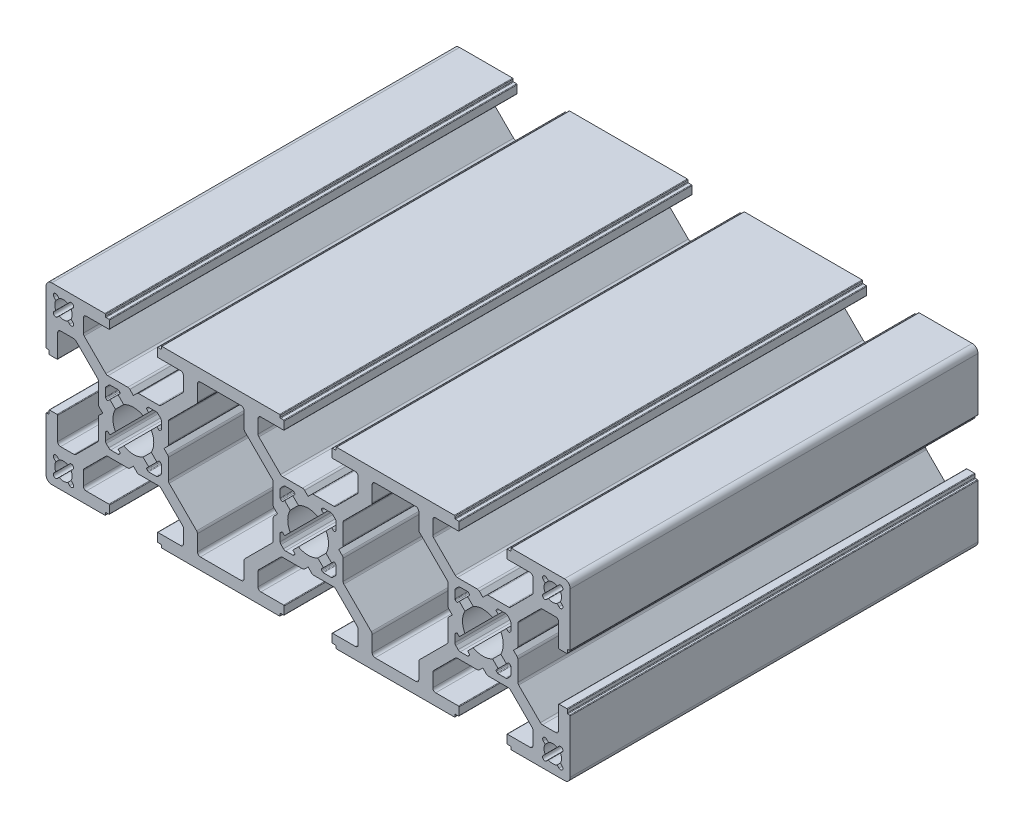
from build123d import *

# Parameters (mm, degrees)
Y_KSEKLIK_EKSTR_ZYON1_DEPTH = 70
Y_KSEKLIK_EKSTR_ZYON2_START = -70
Y_KSEKLIK_EKSTR_ZYON2_DEPTH = 70


# Read off the part's stored shape, not the designer's step: Yükseklik-Ekstrüzyon2
with BuildPart() as part:
    # Çizim1 → Yükseklik-Ekstrüzyon1 (new body)
    with BuildSketch(Plane.XY):
        with BuildLine():
            Line((0.603553391, 5.853553391), (0, 5.25))
            Line((0, 5.25), (0, 3.5))
            ThreePointArc((0, 3.5), (0.858529967, 3.393070335), (1.664601464, 3.078815026))
            Line((1.664601464, 3.078815026), (2.624264069, 4.038477631))
            Line((2.624264069, 4.038477631), (2.341421356, 4.321320344))
            ThreePointArc((2.341421356, 4.321320344), (2.282842712, 4.4627417), (2.341421356, 4.604163056))
            Line((2.341421356, 4.604163056), (2.478679656, 4.741421356))
            ThreePointArc((2.478679656, 4.741421356), (2.543564326, 4.784775907), (2.620101013, 4.8))
            Line((2.620101013, 4.8), (3.885786438, 4.8))
            ThreePointArc((3.885786438, 4.8), (4.077128154, 4.761939766), (4.239339828, 4.653553391))
            Line((4.239339828, 4.653553391), (4.653553391, 4.239339828))
            ThreePointArc((4.653553391, 4.239339828), (4.761939766, 4.077128154), (4.8, 3.885786438))
            Line((4.8, 3.885786438), (4.8, 2.620101013))
            ThreePointArc((4.8, 2.620101013), (4.784775907, 2.543564326), (4.741421356, 2.478679656))
            Line((4.741421356, 2.478679656), (4.604163056, 2.341421356))
            ThreePointArc((4.604163056, 2.341421356), (4.4627417, 2.282842712), (4.321320344, 2.341421356))
            Line((4.321320344, 2.341421356), (4.038477631, 2.624264069))
            Line((4.038477631, 2.624264069), (3.078815026, 1.664601464))
            ThreePointArc((3.078815026, 1.664601464), (3.393070335, 0.858529967), (3.5, 0))
            Line((3.5, 0), (5.25, 0))
            Line((5.25, 0), (5.853553391, 0.603553391))
            ThreePointArc((5.853553391, 0.603553391), (5.961939766, 0.765765065), (6, 0.957106781))
            Line((6, 0.957106781), (6, 4.378679656))
            ThreePointArc((6, 4.378679656), (6.038060234, 4.570021373), (6.146446609, 4.732233047))
            Line((6.146446609, 4.732233047), (9.867766953, 8.453553391))
            Line((9.867766953, 8.453553391), (10.853553391, 9.439339828))
            ThreePointArc((10.853553391, 9.439339828), (10.961939766, 9.601551503), (11, 9.792893219))
            Line((11, 9.792893219), (11, 12.5))
            ThreePointArc((11, 12.5), (11.146446609, 12.853553391), (11.5, 13))
            Line((11.5, 13), (15, 13))
            Line((15, 13), (15, 15))
            Line((15, 15), (14, 15))
            Line((14, 15), (4.9, 15))
            ThreePointArc((4.9, 15), (4.829289322, 14.970710678), (4.8, 14.9))
            Line((4.8, 14.9), (4.8, 14.6))
            ThreePointArc((4.8, 14.6), (4.770710678, 14.529289322), (4.7, 14.5))
            Line((4.7, 14.5), (4.2, 14.5))
            ThreePointArc((4.2, 14.5), (4.129289322, 14.470710678), (4.1, 14.4))
            Line((4.1, 14.4), (4.1, 13.1))
            ThreePointArc((4.1, 13.1), (4.129289322, 13.029289322), (4.2, 13))
            Line((4.2, 13), (8.1, 13))
            ThreePointArc((8.1, 13), (8.453553391, 12.853553391), (8.6, 12.5))
            Line((8.6, 12.5), (8.6, 10.221320344))
            ThreePointArc((8.6, 10.221320344), (8.561939766, 10.029978627), (8.453553391, 9.867766953))
            Line((8.453553391, 9.867766953), (4.732233047, 6.146446609))
            ThreePointArc((4.732233047, 6.146446609), (4.570021373, 6.038060234), (4.378679656, 6))
            Line((4.378679656, 6), (0.957106781, 6))
            ThreePointArc((0.957106781, 6), (0.765765065, 5.961939766), (0.603553391, 5.853553391))
        make_face()
        with BuildLine():
            Line((5.25, 0), (3.5, 0))
            ThreePointArc((3.5, 0), (3.393070335, -0.858529967), (3.078815026, -1.664601464))
            Line((3.078815026, -1.664601464), (4.038477631, -2.624264069))
            Line((4.038477631, -2.624264069), (4.321320344, -2.341421356))
            ThreePointArc((4.321320344, -2.341421356), (4.4627417, -2.282842712), (4.604163056, -2.341421356))
            Line((4.604163056, -2.341421356), (4.741421356, -2.478679656))
            ThreePointArc((4.741421356, -2.478679656), (4.784775907, -2.543564326), (4.8, -2.620101013))
            Line((4.8, -2.620101013), (4.8, -3.885786438))
            ThreePointArc((4.8, -3.885786438), (4.761939766, -4.077128154), (4.653553391, -4.239339828))
            Line((4.653553391, -4.239339828), (4.239339828, -4.653553391))
            ThreePointArc((4.239339828, -4.653553391), (4.077128154, -4.761939766), (3.885786438, -4.8))
            Line((3.885786438, -4.8), (2.620101013, -4.8))
            ThreePointArc((2.620101013, -4.8), (2.543564326, -4.784775907), (2.478679656, -4.741421356))
            Line((2.478679656, -4.741421356), (2.341421356, -4.604163056))
            ThreePointArc((2.341421356, -4.604163056), (2.282842712, -4.4627417), (2.341421356, -4.321320344))
            Line((2.341421356, -4.321320344), (2.624264069, -4.038477631))
            Line((2.624264069, -4.038477631), (1.664601464, -3.078815026))
            ThreePointArc((1.664601464, -3.078815026), (0.858529967, -3.393070335), (0, -3.5))
            Line((0, -3.5), (0, -5.25))
            Line((0, -5.25), (0.603553391, -5.853553391))
            ThreePointArc((0.603553391, -5.853553391), (0.765765065, -5.961939766), (0.957106781, -6))
            Line((0.957106781, -6), (4.378679656, -6))
            ThreePointArc((4.378679656, -6), (4.570021373, -6.038060234), (4.732233047, -6.146446609))
            Line((4.732233047, -6.146446609), (8.453553391, -9.867766953))
            ThreePointArc((8.453553391, -9.867766953), (8.561939766, -10.029978627), (8.6, -10.221320344))
            Line((8.6, -10.221320344), (8.6, -12.5))
            ThreePointArc((8.6, -12.5), (8.453553391, -12.853553391), (8.1, -13))
            Line((8.1, -13), (4.2, -13))
            ThreePointArc((4.2, -13), (4.129289322, -13.029289322), (4.1, -13.1))
            Line((4.1, -13.1), (4.1, -14.4))
            ThreePointArc((4.1, -14.4), (4.129289322, -14.470710678), (4.2, -14.5))
            Line((4.2, -14.5), (4.7, -14.5))
            ThreePointArc((4.7, -14.5), (4.770710678, -14.529289322), (4.8, -14.6))
            Line((4.8, -14.6), (4.8, -14.9))
            ThreePointArc((4.8, -14.9), (4.829289322, -14.970710678), (4.9, -15))
            Line((4.9, -15), (14, -15))
            Line((14, -15), (15, -15))
            Line((15, -15), (15, -13))
            Line((15, -13), (11.5, -13))
            ThreePointArc((11.5, -13), (11.146446609, -12.853553391), (11, -12.5))
            Line((11, -12.5), (11, -9.792893219))
            ThreePointArc((11, -9.792893219), (10.961939766, -9.601551503), (10.853553391, -9.439339828))
            Line((10.853553391, -9.439339828), (9.867766953, -8.453553391))
            Line((9.867766953, -8.453553391), (6.146446609, -4.732233047))
            ThreePointArc((6.146446609, -4.732233047), (6.038060234, -4.570021373), (6, -4.378679656))
            Line((6, -4.378679656), (6, -0.957106781))
            ThreePointArc((6, -0.957106781), (5.961939766, -0.765765065), (5.853553391, -0.603553391))
            Line((5.853553391, -0.603553391), (5.25, 0))
        make_face()
    extrude(amount=-Y_KSEKLIK_EKSTR_ZYON1_DEPTH)

    # Aynalama1: part across plane


with BuildPart() as part_1:
    add(part.part)
    add(part.part.mirror(Plane(origin=(15, 0, -70), x_dir=(0, 0, 1), z_dir=(1, 0, 0))))

    # Aynalama2: part across face


with BuildPart() as part_2:
    add(part_1.part)
    add(part_1.part.mirror(Plane(origin=(30, -4.375, -35), x_dir=(0, 0, 1), z_dir=(1, 0, 0))))

    # Yükseklik-Ekstrüzyon2 outline → Yükseklik-Ekstrüzyon2 (add)
    with BuildSketch(Plane.XY.offset(Y_KSEKLIK_EKSTR_ZYON2_START)):
        with BuildLine():
            ThreePointArc((-8.6, -10.221320344), (-8.561939766, -10.029978628), (-8.453553391, -9.867766953))
            Line((-8.453553391, -9.867766953), (-4.732233047, -6.146446609))
            ThreePointArc((-4.732233047, -6.146446609), (-4.570021372, -6.038060234), (-4.378679656, -6))
            Line((-4.378679656, -6), (-0.957106781, -6))
            ThreePointArc((-0.957106781, -6), (-0.765765065, -5.961939766), (-0.603553391, -5.853553391))
            Line((-0.603553391, -5.853553391), (0, -5.25))
            Line((0, -5.25), (0, -3.5))
            ThreePointArc((0, -3.5), (-0.858529967, -3.393070335), (-1.664601464, -3.078815026))
            Line((-1.664601464, -3.078815026), (-2.624264069, -4.038477631))
            Line((-2.624264069, -4.038477631), (-2.341421356, -4.321320344))
            ThreePointArc((-2.341421356, -4.321320344), (-2.282842712, -4.4627417), (-2.341421356, -4.604163056))
            Line((-2.341421356, -4.604163056), (-2.478679656, -4.741421356))
            ThreePointArc((-2.478679656, -4.741421356), (-2.543564326, -4.784775907), (-2.620101013, -4.8))
            Line((-2.620101013, -4.8), (-3.885786438, -4.8))
            ThreePointArc((-3.885786438, -4.8), (-4.077128154, -4.761939766), (-4.239339828, -4.653553391))
            Line((-4.239339828, -4.653553391), (-4.653553391, -4.239339828))
            ThreePointArc((-4.653553391, -4.239339828), (-4.761939766, -4.077128154), (-4.8, -3.885786438))
            Line((-4.8, -3.885786438), (-4.8, -2.620101013))
            ThreePointArc((-4.8, -2.620101013), (-4.784775907, -2.543564326), (-4.741421356, -2.478679656))
            Line((-4.741421356, -2.478679656), (-4.604163056, -2.341421356))
            ThreePointArc((-4.604163056, -2.341421356), (-4.4627417, -2.282842712), (-4.321320344, -2.341421356))
            Line((-4.321320344, -2.341421356), (-4.038477631, -2.624264069))
            Line((-4.038477631, -2.624264069), (-3.078815026, -1.664601464))
            ThreePointArc((-3.078815026, -1.664601464), (-3.5, 0), (-3.078815026, 1.664601464))
            Line((-3.078815026, 1.664601464), (-4.038477631, 2.624264069))
            Line((-4.038477631, 2.624264069), (-4.321320344, 2.341421356))
            ThreePointArc((-4.321320344, 2.341421356), (-4.4627417, 2.282842712), (-4.604163056, 2.341421356))
            Line((-4.604163056, 2.341421356), (-4.741421356, 2.478679656))
            ThreePointArc((-4.741421356, 2.478679656), (-4.784775907, 2.543564326), (-4.8, 2.620101013))
            Line((-4.8, 2.620101013), (-4.8, 3.885786438))
            ThreePointArc((-4.8, 3.885786438), (-4.761939766, 4.077128154), (-4.653553391, 4.239339828))
            Line((-4.653553391, 4.239339828), (-4.239339828, 4.653553391))
            ThreePointArc((-4.239339828, 4.653553391), (-4.077128154, 4.761939766), (-3.885786438, 4.8))
            Line((-3.885786438, 4.8), (-2.620101013, 4.8))
            ThreePointArc((-2.620101013, 4.8), (-2.543564326, 4.784775907), (-2.478679656, 4.741421356))
            Line((-2.478679656, 4.741421356), (-2.341421356, 4.604163056))
            ThreePointArc((-2.341421356, 4.604163056), (-2.282842712, 4.4627417), (-2.341421356, 4.321320344))
            Line((-2.341421356, 4.321320344), (-2.624264069, 4.038477631))
            Line((-2.624264069, 4.038477631), (-1.664601464, 3.078815026))
            ThreePointArc((-1.664601464, 3.078815026), (-0.858529967, 3.393070335), (0, 3.5))
            Line((0, 3.5), (0, 5.25))
            Line((0, 5.25), (-0.603553391, 5.853553391))
            ThreePointArc((-0.603553391, 5.853553391), (-0.765765065, 5.961939766), (-0.957106781, 6))
            Line((-0.957106781, 6), (-4.378679656, 6))
            ThreePointArc((-4.378679656, 6), (-4.570021372, 6.038060234), (-4.732233047, 6.146446609))
            Line((-4.732233047, 6.146446609), (-8.453553391, 9.867766953))
            ThreePointArc((-8.453553391, 9.867766953), (-8.561939766, 10.029978628), (-8.6, 10.221320344))
            Line((-8.6, 10.221320344), (-8.6, 12.5))
            ThreePointArc((-8.6, 12.5), (-8.453553391, 12.853553391), (-8.1, 13))
            Line((-8.1, 13), (-4.2, 13))
            ThreePointArc((-4.2, 13), (-4.129289322, 13.029289322), (-4.1, 13.1))
            Line((-4.1, 13.1), (-4.1, 14.4))
            ThreePointArc((-4.1, 14.4), (-4.129289322, 14.470710678), (-4.2, 14.5))
            Line((-4.2, 14.5), (-4.7, 14.5))
            ThreePointArc((-4.7, 14.5), (-4.770710678, 14.529289322), (-4.8, 14.6))
            Line((-4.8, 14.6), (-4.8, 14.9))
            ThreePointArc((-4.8, 14.9), (-4.829289322, 14.970710678), (-4.9, 15))
            Line((-4.9, 15), (-14, 15))
            ThreePointArc((-14, 15), (-14.707106781, 14.707106781), (-15, 14))
            Line((-15, 14), (-15, 4.9))
            ThreePointArc((-15, 4.9), (-14.970710678, 4.829289322), (-14.9, 4.8))
            Line((-14.9, 4.8), (-14.6, 4.8))
            ThreePointArc((-14.6, 4.8), (-14.529289322, 4.770710678), (-14.5, 4.7))
            Line((-14.5, 4.7), (-14.5, 4.2))
            ThreePointArc((-14.5, 4.2), (-14.470710678, 4.129289322), (-14.4, 4.1))
            Line((-14.4, 4.1), (-13.1, 4.1))
            ThreePointArc((-13.1, 4.1), (-13.029289322, 4.129289322), (-13, 4.2))
            Line((-13, 4.2), (-13, 8.1))
            ThreePointArc((-13, 8.1), (-12.853553391, 8.453553391), (-12.5, 8.6))
            Line((-12.5, 8.6), (-10.221320344, 8.6))
            ThreePointArc((-10.221320344, 8.6), (-10.029978628, 8.561939766), (-9.867766953, 8.453553391))
            Line((-9.867766953, 8.453553391), (-6.146446609, 4.732233047))
            ThreePointArc((-6.146446609, 4.732233047), (-6.038060234, 4.570021372), (-6, 4.378679656))
            Line((-6, 4.378679656), (-6, 0.957106781))
            ThreePointArc((-6, 0.957106781), (-5.961939766, 0.765765065), (-5.853553391, 0.603553391))
            Line((-5.853553391, 0.603553391), (-5.25, 0))
            Line((-5.25, 0), (-5.853553391, -0.603553391))
            ThreePointArc((-5.853553391, -0.603553391), (-5.961939766, -0.765765065), (-6, -0.957106781))
            Line((-6, -0.957106781), (-6, -4.378679656))
            ThreePointArc((-6, -4.378679656), (-6.038060234, -4.570021372), (-6.146446609, -4.732233047))
            Line((-6.146446609, -4.732233047), (-9.867766953, -8.453553391))
            ThreePointArc((-9.867766953, -8.453553391), (-10.029978628, -8.561939766), (-10.221320344, -8.6))
            Line((-10.221320344, -8.6), (-12.5, -8.6))
            ThreePointArc((-12.5, -8.6), (-12.853553391, -8.453553391), (-13, -8.1))
            Line((-13, -8.1), (-13, -4.2))
            ThreePointArc((-13, -4.2), (-13.029289322, -4.129289322), (-13.1, -4.1))
            Line((-13.1, -4.1), (-14.4, -4.1))
            ThreePointArc((-14.4, -4.1), (-14.470710678, -4.129289322), (-14.5, -4.2))
            Line((-14.5, -4.2), (-14.5, -4.7))
            ThreePointArc((-14.5, -4.7), (-14.529289322, -4.770710678), (-14.6, -4.8))
            Line((-14.6, -4.8), (-14.9, -4.8))
            ThreePointArc((-14.9, -4.8), (-14.970710678, -4.829289322), (-15, -4.9))
            Line((-15, -4.9), (-15, -14))
            ThreePointArc((-15, -14), (-14.707106781, -14.707106781), (-14, -15))
            Line((-14, -15), (-4.9, -15))
            ThreePointArc((-4.9, -15), (-4.829289322, -14.970710678), (-4.8, -14.9))
            Line((-4.8, -14.9), (-4.8, -14.6))
            ThreePointArc((-4.8, -14.6), (-4.770710678, -14.529289322), (-4.7, -14.5))
            Line((-4.7, -14.5), (-4.2, -14.5))
            ThreePointArc((-4.2, -14.5), (-4.129289322, -14.470710678), (-4.1, -14.4))
            Line((-4.1, -14.4), (-4.1, -13.1))
            ThreePointArc((-4.1, -13.1), (-4.129289322, -13.029289322), (-4.2, -13))
            Line((-4.2, -13), (-8.1, -13))
            ThreePointArc((-8.1, -13), (-8.453553391, -12.853553391), (-8.6, -12.5))
            Line((-8.6, -12.5), (-8.6, -10.221320344))
        make_face()
        with BuildLine():
            ThreePointArc((-13.060660172, -13.626345597), (-13.626345597, -13.626345597), (-13.626345597, -13.060660172))
            Line((-13.626345597, -13.060660172), (-13.305095127, -12.739409703))
            ThreePointArc((-13.305095127, -12.739409703), (-13.5, -12), (-13.305095127, -11.260590297))
            Line((-13.305095127, -11.260590297), (-13.626345597, -10.939339828))
            ThreePointArc((-13.626345597, -10.939339828), (-13.626345597, -10.373654403), (-13.060660172, -10.373654403))
            Line((-13.060660172, -10.373654403), (-12.739409703, -10.694904873))
            ThreePointArc((-12.739409703, -10.694904873), (-12, -10.5), (-11.260590297, -10.694904873))
            Line((-11.260590297, -10.694904873), (-10.939339828, -10.373654403))
            ThreePointArc((-10.939339828, -10.373654403), (-10.373654403, -10.373654403), (-10.373654403, -10.939339828))
            Line((-10.373654403, -10.939339828), (-10.694904873, -11.260590297))
            ThreePointArc((-10.694904873, -11.260590297), (-10.5, -12), (-10.694904873, -12.739409703))
            Line((-10.694904873, -12.739409703), (-10.373654403, -13.060660172))
            ThreePointArc((-10.373654403, -13.060660172), (-10.373654403, -13.626345597), (-10.939339828, -13.626345597))
            Line((-10.939339828, -13.626345597), (-11.260590297, -13.305095127))
            ThreePointArc((-11.260590297, -13.305095127), (-12, -13.5), (-12.739409703, -13.305095127))
            Line((-12.739409703, -13.305095127), (-13.060660172, -13.626345597))
        make_face(mode=Mode.SUBTRACT)
        with BuildLine():
            ThreePointArc((-13.626345597, 13.060660172), (-13.626345597, 13.626345597), (-13.060660172, 13.626345597))
            Line((-13.060660172, 13.626345597), (-12.739409703, 13.305095127))
            ThreePointArc((-12.739409703, 13.305095127), (-12, 13.5), (-11.260590297, 13.305095127))
            Line((-11.260590297, 13.305095127), (-10.939339828, 13.626345597))
            ThreePointArc((-10.939339828, 13.626345597), (-10.373654403, 13.626345597), (-10.373654403, 13.060660172))
            Line((-10.373654403, 13.060660172), (-10.694904873, 12.739409703))
            ThreePointArc((-10.694904873, 12.739409703), (-10.5, 12), (-10.694904873, 11.260590297))
            Line((-10.694904873, 11.260590297), (-10.373654403, 10.939339828))
            ThreePointArc((-10.373654403, 10.939339828), (-10.373654403, 10.373654403), (-10.939339828, 10.373654403))
            Line((-10.939339828, 10.373654403), (-11.260590297, 10.694904873))
            ThreePointArc((-11.260590297, 10.694904873), (-12, 10.5), (-12.739409703, 10.694904873))
            Line((-12.739409703, 10.694904873), (-13.060660172, 10.373654403))
            ThreePointArc((-13.060660172, 10.373654403), (-13.626345597, 10.373654403), (-13.626345597, 10.939339828))
            Line((-13.626345597, 10.939339828), (-13.305095127, 11.260590297))
            ThreePointArc((-13.305095127, 11.260590297), (-13.5, 12), (-13.305095127, 12.739409703))
            Line((-13.305095127, 12.739409703), (-13.626345597, 13.060660172))
        make_face(mode=Mode.SUBTRACT)
    y_kseklik_ekstr_zyon2 = extrude(amount=Y_KSEKLIK_EKSTR_ZYON2_DEPTH)

    # Aynalama6: Yükseklik-Ekstrüzyon2 across plane
    add(y_kseklik_ekstr_zyon2.mirror(Plane(origin=(30, 0, 0), x_dir=(0, 0, 1), z_dir=(1, 0, 0))))


solid = part_2.part
